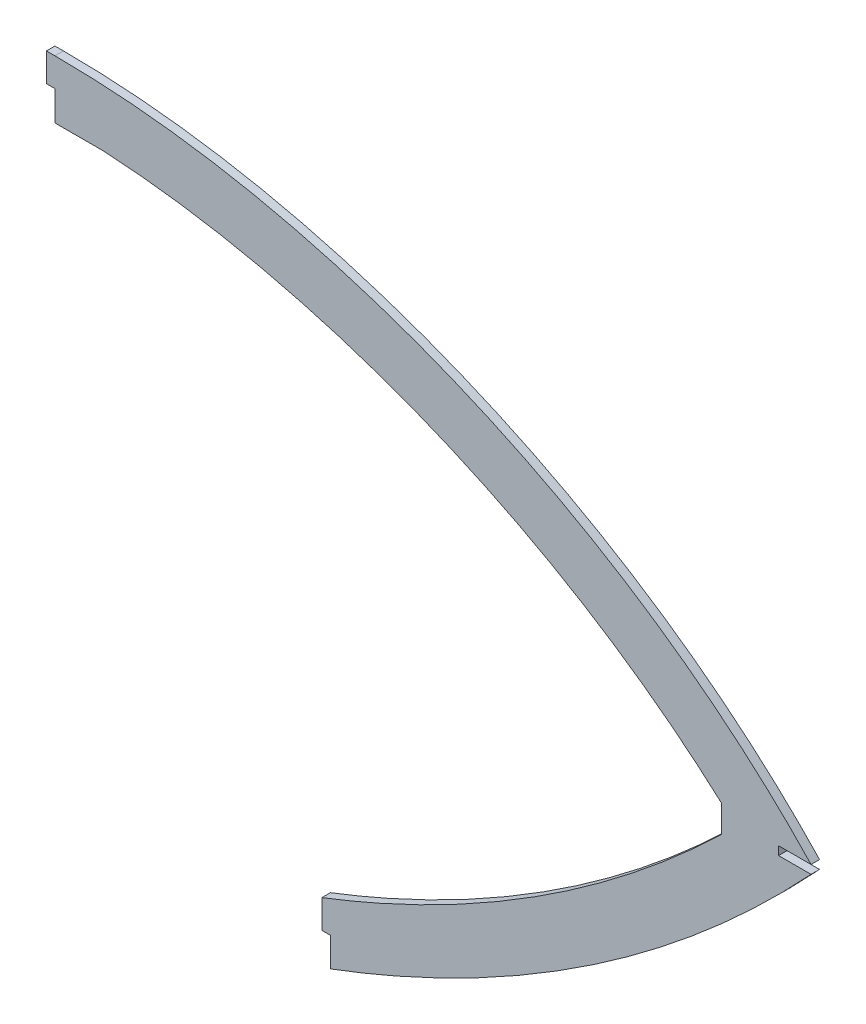
from build123d import *

# Parameters (mm, degrees)
BOSS_EXTRUDE1_DEPTH = 1.5


with BuildPart() as part:
    # Sketch1 → Boss-Extrude1 (new, symmetric)
    with BuildSketch(Plane.XY):
        with BuildLine():
            Line((162, 160.5), (159, 160.5))
            Line((159, 160.5), (159, 150.5))
            Line((159, 150.5), (162, 150.5))
            Line((162, 150.5), (162, 140.021619695))
            Line((162, 140.021619695), (179.035361639, 140.021619695))
            add(Edge.make_bspline(
                [(179.035361639, 140.021619695), (181.45177758, 139.887166151), (186.271210948, 139.563639144), (195.976712465, 138.692648533), (208.159899275, 137.190549701), (222.833276173, 134.736731876), (242.399897845, 130.612978325), (266.747664338, 123.892143887), (295.413182721, 113.431330715), (323.15664222, 100.694908753), (345.202971848, 88.292281007), (362.016251386, 77.366035054), (374.171038921, 68.686714489), (383.882043125, 61.067655319), (391.384292246, 54.745059633), (395.0336858, 51.518085922), (396.841652361, 49.879913246)],
                knots=[0.062605333, 0.062605333, 0.062605333, 0.062605333, 0.088988821, 0.115372309, 0.168139285, 0.220906261, 0.273673237, 0.379207188, 0.48474114, 0.590275092, 0.695809044, 0.74857602, 0.801342996, 0.854109972, 0.88049346, 0.906876948, 0.906876948, 0.906876948, 0.906876948], degree=3))
            Line((396.841652361, 49.879913246), (396.841652361, 40.472770569))
            add(Edge.make_bspline(
                [(396.841652361, 40.472770569), (394.239003509, 37.95960097), (388.96143719, 32.990251003), (378.229519399, 23.38737088), (364.429910147, 11.961116896), (347.266061562, -0.817277502), (329.487497816, -12.672358899), (311.087846085, -23.60783791), (292.061195088, -33.626734834), (275.67051051, -41.216070908), (263.560614652, -46.277800296), (258.079868587, -48.440474349), (255.999999882, -49.243263144)],
                knots=[0.498678358, 0.498678358, 0.498678358, 0.498678358, 0.498869027, 0.499059696, 0.499441034, 0.499822372, 0.50020371, 0.500585048, 0.500966386, 0.501347724, 0.501538394, 0.501654418, 0.501654418, 0.501654418, 0.501654418], degree=3))
            Line((255.999999882, -49.243263144), (256, -59.243263104))
            Line((256, -59.243263104), (259, -59.243263104))
            Line((259, -59.243263104), (259, -69.5))
            add(Edge.make_bspline(
                [(428.29663113, 44), (357.033753936, -32.746716062), (259, -69.5)],
                knots=[0, 0, 0, 1, 1, 1], degree=2))
            Line((428.29663113, 44), (416.841652361, 44))
            Line((416.841652361, 44), (416.841652361, 47))
            Line((416.841652361, 47), (428.287791795, 47.000000003))
            add(Edge.make_bspline(
                [(162, 160.5), (257.401986757, 160.520726955), (362.21107198, 117.350026503), (428.287791795, 47.000000003)],
                knots=[0, 0, 0, 0, 0.993095849, 0.993095849, 0.993095849, 0.993095849], degree=3))
        make_face()
    extrude(amount=BOSS_EXTRUDE1_DEPTH, both=True)


solid = part.part
